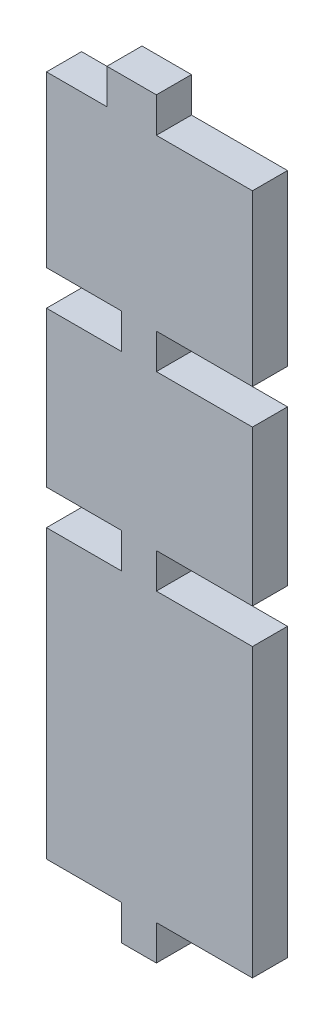
from build123d import *

# Parameters (mm, degrees)
BOSS_EXTRUDE1_DEPTH = 1.524


with BuildPart() as part:
    # Sketch1 → Boss-Extrude1 (new body)
    with BuildSketch(Plane.XY):
        Polygon((4.271141743, -1.524), (4.271141743, 0), (1.021265613, 0), (1.021265613, 6.732723008), (4.271141743, 6.732723008), (4.271141743, 8.256723008), (1.021265613, 8.256723008), (1.021265613, 15.622723008), (3.64643061, 15.622723008), (3.64643061, 17.146723008), (5.795141743, 17.146723008), (5.795141743, 15.622723008), (9.967924668, 15.622723008), (9.967924668, 8.256723008), (5.795141743, 8.256723008), (5.795141743, 6.732723008), (9.967924668, 6.732723008), (9.967924668, 0), (5.795141743, 0), (5.795141743, -1.524), (9.967924668, -1.524), (9.967924668, -13.993497683), (5.795141743, -13.993497683), (5.795141743, -15.517497683), (4.271141743, -15.517497683), (4.271141743, -13.993497683), (1.021265613, -13.993497683), (1.021265613, -1.524), align=None)
    extrude(amount=BOSS_EXTRUDE1_DEPTH)


solid = part.part
